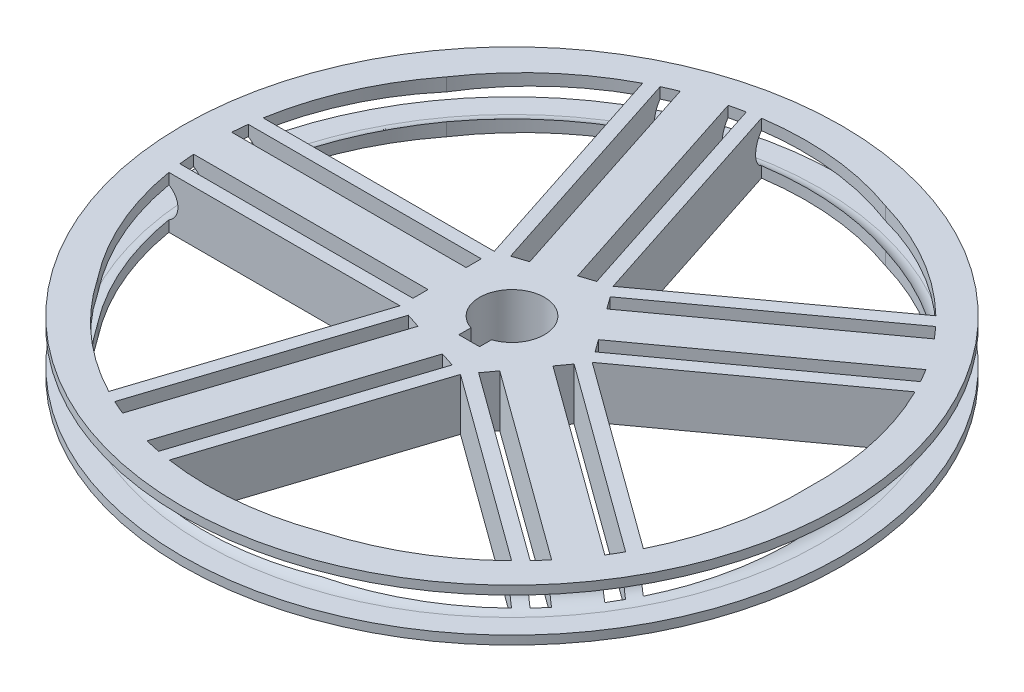
from build123d import *

# Parameters (mm, degrees)
SKETCH2_R          = 7.5
CUT_EXTRUDE3_DEPTH = 167.364659709
SKETCH5_W          = 4.78
SKETCH5_H          = 3.196434647
CUT_EXTRUDE5_DEPTH = 167.364659709
CUT_EXTRUDE7_DEPTH = 167.364659709
CIRPATTERN1_COUNT  = 5


with BuildPart() as part:
    # Sketch1 → Revolve2 (revolve)
    with BuildSketch(Plane.XY):
        with BuildLine():
            Line((0, 8), (-5, 8))
            Line((-5, 8), (-5, 10))
            Line((-5, 10), (71.2, 10))
            Line((71.2, 10), (71.2, -2))
            Line((71.2, -2), (-5, -2))
            Line((-5, -2), (-5, 0))
            Line((-5, 0), (0, 0))
            ThreePointArc((0, 0), (4, 4), (0, 8))
        make_face()
    revolve(axis=Axis((71.2, 10, 0), (0, -1, 0)))

    # Sketch2 → Cut-Extrude3 (cut, through all)
    with BuildSketch(Plane.XZ.offset(2)):
        with Locations((71.2, 0)):
            Circle(SKETCH2_R)
    extrude(amount=-CUT_EXTRUDE3_DEPTH, mode=Mode.SUBTRACT)

    # Sketch5 → Cut-Extrude5 (cut, through all)
    with BuildSketch(Plane.XZ.offset(2)):
        with Locations((71.2, 8.291782677)):
            Rectangle(SKETCH5_W, SKETCH5_H)
    extrude(amount=-CUT_EXTRUDE5_DEPTH, mode=Mode.SUBTRACT)

    # Sketch3 → Cut-Extrude7 (cut, symmetric)
    with BuildSketch(Plane.XZ.offset(2)):
        with BuildLine():
            Line((132.947274662, 31.391181733), (89.741019662, 0))
            Line((89.741019662, 0), (139.741019662, 0))
            ThreePointArc((139.741019662, 0), (138.299587937, 16.118791436), (132.947274662, 31.391181733))
        make_face()
        with BuildLine():
            Line((85.920415523, 5.258610463), (87.977663906, 2.427050983))
            Line((87.977663906, 2.427050983), (131.536171446, 34.074159167))
            ThreePointArc((131.536171446, 34.074159167), (130.661498919, 35.599049135), (129.746188216, 37.099898148))
            Line((129.746188216, 37.099898148), (85.920415523, 5.258610463))
        make_face()
        with BuildLine():
            Line((92.380339887, 65.186383384), (76.929490169, 17.633557569))
            Line((76.929490169, 17.633557569), (120.135745169, 49.024739302))
            ThreePointArc((120.135745169, 49.024739302), (107.264794618, 58.834519866), (92.380339887, 65.186383384))
        make_face()
        with BuildLine():
            Line((78.692845926, 15.206506586), (80.750094309, 12.374947105))
            Line((80.750094309, 12.374947105), (124.575867002, 44.21623479))
            ThreePointArc((124.575867002, 44.21623479), (123.431321331, 45.55053485), (122.251353466, 46.85361477))
            Line((122.251353466, 46.85361477), (78.692845926, 15.206506586))
        make_face()
    cut_extrude7 = extrude(amount=CUT_EXTRUDE7_DEPTH, both=True, mode=Mode.SUBTRACT)

    # CirPattern1: Cut-Extrude7 ×5 about axis
    cirpattern1_axis = Axis((71.2, -2, 0), (0, -1, 0))
    for i in range(1, CIRPATTERN1_COUNT):
        add(cut_extrude7.rotate(cirpattern1_axis, i * 360 / CIRPATTERN1_COUNT), mode=Mode.SUBTRACT)


solid = part.part
